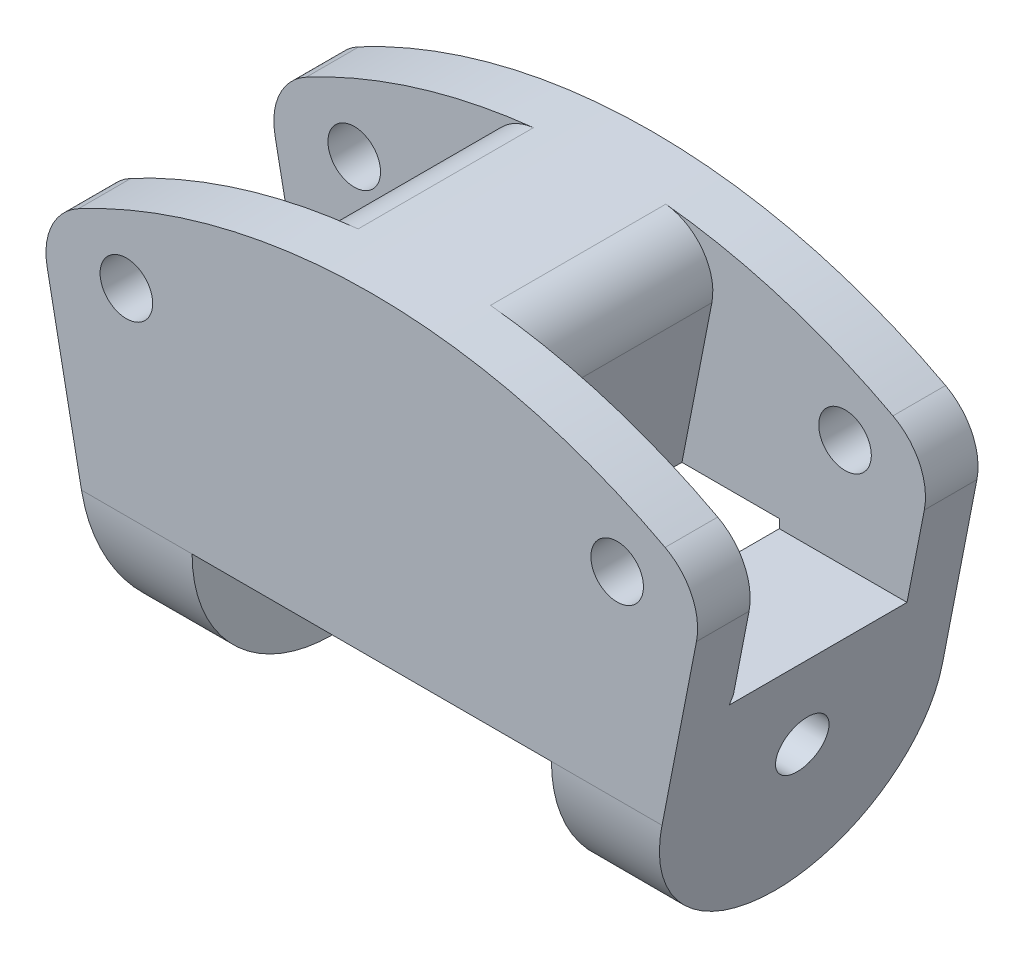
from build123d import *

# Parameters (mm, degrees)
ESQUISSE1_R                  = 1.5
BOSS_EXTRU_1_DEPTH           = 8
CONG_1_R                     = 8
ESQUISSE2_W                  = 20.5
ESQUISSE2_H                  = 8.937448888
ENL_V_MAT_EXTRU_1_DEPTH      = 10
ENL_V_MAT_EXTRU_2_DEPTH      = 5
ESQUISSE4_W                  = 5.650854606
ESQUISSE4_H                  = 10
ENL_V_MAT_EXTRU_3_DEPTH      = 5
ENL_V_MAT_EXTRU_4_DEPTH      = 40.644055588
ENL_V_MAT_EXTRU_4_DEPTH_BACK = 40.644055588
ESQUISSE6_R                  = 1.5
ENL_V_MAT_EXTRU_5_REACH      = 37.743
ESQUISSE7_W                  = 20.5
ESQUISSE7_H                  = 5.5
CHANFREIN1_SIZE2             = 1.5
CHANFREIN1_SIZE              = 5.5
CONG_2_R                     = 3


with BuildPart() as part:
    # Esquisse1 → Boss.-Extru.1 (new, symmetric)
    with BuildSketch(Plane.XY):
        with BuildLine():
            Line((15, 0), (-15, 0))
            Line((-15, 0), (-18.52357943, 18.05834458))
            ThreePointArc((-18.52357943, 18.05834458), (-18.248833113, 20.232434219), (-16.735143225, 21.817014359))
            ThreePointArc((-16.735143225, 21.817014359), (0, 26), (16.735143225, 21.817014359))
            ThreePointArc((16.735143225, 21.817014359), (18.248833113, 20.232434219), (18.52357943, 18.05834458))
            Line((18.52357943, 18.05834458), (15, 0))
        make_face()
        with Locations((-14, 19.25)):
            Circle(ESQUISSE1_R, mode=Mode.SUBTRACT)
        with Locations(Location((14, 19.25, 0), (0, 0, 180))):
            Circle(ESQUISSE1_R, mode=Mode.SUBTRACT)
    extrude(amount=BOSS_EXTRU_1_DEPTH, both=True)

    # Congé1
    cong_1_edges = [part.edges().sort_by_distance(p)[0] for p in [
        (0, 0, -8),
        (0, 0, 8),
    ]]
    fillet(cong_1_edges, radius=CONG_1_R - 0.0001)  # a hair under: the kernel refuses the full size

    # Esquisse2 → Enlèv. mat.-Extru.1 (cut, symmetric)
    with BuildSketch(Plane.XY):
        with Locations((0, 3.531275556)):
            Rectangle(ESQUISSE2_W, ESQUISSE2_H)
    extrude(amount=ENL_V_MAT_EXTRU_1_DEPTH, both=True, mode=Mode.SUBTRACT)

    # Esquisse3 → Enlèv. mat.-Extru.2 (cut, symmetric)
    with BuildSketch(Plane.XY):
        with BuildLine():
            Line((7, 25.304379858), (4.599145394, 13))
            Line((4.599145394, 13), (17.536585366, 13))
            Line((17.536585366, 13), (18.52357943, 18.05834458))
            ThreePointArc((18.52357943, 18.05834458), (18.248833113, 20.232434219), (16.735143225, 21.817014359))
            ThreePointArc((16.735143225, 21.817014359), (11.994985849, 23.916379883), (7, 25.304379858))
        make_face()
        with BuildLine():
            Line((-17.536585366, 13), (-18.52357943, 18.05834458))
            ThreePointArc((-18.52357943, 18.05834458), (-18.248833113, 20.232434219), (-16.735143225, 21.817014359))
            ThreePointArc((-16.735143225, 21.817014359), (-11.994985849, 23.916379883), (-7, 25.304379858))
            Line((-7, 25.304379858), (-4.599145394, 13))
            Line((-4.599145394, 13), (-17.536585366, 13))
        make_face()
    extrude(amount=ENL_V_MAT_EXTRU_2_DEPTH, both=True, mode=Mode.SUBTRACT)

    # Esquisse4 → Enlèv. mat.-Extru.3 (cut)
    with BuildSketch(Plane(origin=(0, 13, 0), x_dir=(1, 0, 0), z_dir=(0, 1, 0))):
        with Locations((7.424572697, 0)):
            Rectangle(ESQUISSE4_W, ESQUISSE4_H)
        with Locations((-7.424572697, 0)):
            Rectangle(ESQUISSE4_W, ESQUISSE4_H)
    extrude(amount=-ENL_V_MAT_EXTRU_3_DEPTH, mode=Mode.SUBTRACT)

    # Esquisse6 → Enlèv. mat.-Extru.4 (cut, two sides: drawn at the far end of the back side and taken through both)
    with BuildSketch(Plane.ZY.offset(-10.25).offset(-ENL_V_MAT_EXTRU_4_DEPTH_BACK)):
        with Locations(Location((0, 8, 0), (0, 0, 270))):
            Circle(ESQUISSE6_R)
    extrude(amount=ENL_V_MAT_EXTRU_4_DEPTH + ENL_V_MAT_EXTRU_4_DEPTH_BACK, mode=Mode.SUBTRACT)

    # Enlèv. mat.-Extru.5: up to this face of the body (flat: up to its plane)
    enl_v_mat_extru_5_end = Plane(part.part.faces().sort_by_distance((10.657947806, 16.753093671, 5))[0])
    # Esquisse7 → Enlèv. mat.-Extru.5 (cut, up to the picked face)
    with BuildSketch(Plane(origin=(0, 0, -8), x_dir=(-1, 0, 0), z_dir=(0, 0, -1)), mode=Mode.PRIVATE) as enl_v_mat_extru_5_sk1:
        with Locations((0, 10.75)):
            Rectangle(ESQUISSE7_W, ESQUISSE7_H)
    enl_v_mat_extru_5_tool1 = split(extrude(enl_v_mat_extru_5_sk1.sketch, amount=-ENL_V_MAT_EXTRU_5_REACH, mode=Mode.PRIVATE), bisect_by=enl_v_mat_extru_5_end, keep=Keep.BOTH, mode=Mode.PRIVATE)
    add(enl_v_mat_extru_5_tool1.solids().sort_by(Axis((0, 10.75, -8), (0, 0, 1)))[0], mode=Mode.SUBTRACT)

    # Chanfrein1
    chanfrein1_edges = [part.edges().sort_by_distance(p)[0] for p in [
        (0, 8, 5),
    ]]
    chanfrein1_side = [part.faces().sort_by_distance(p)[0] for p in [
        (0, 8.03, 5),
    ]]
    chamfer(chanfrein1_edges, length=CHANFREIN1_SIZE - 0.0001, length2=CHANFREIN1_SIZE2 - 0.0001, reference=chanfrein1_side[0])  # a hair under: the kernel refuses the full size

    # Congé2
    cong_2_edges = [part.edges().sort_by_distance(p)[0] for p in [
        (7, 25.304379858, 0),
        (-7, 25.304379858, 0),
    ]]
    fillet(cong_2_edges, radius=CONG_2_R)


solid = part.part
